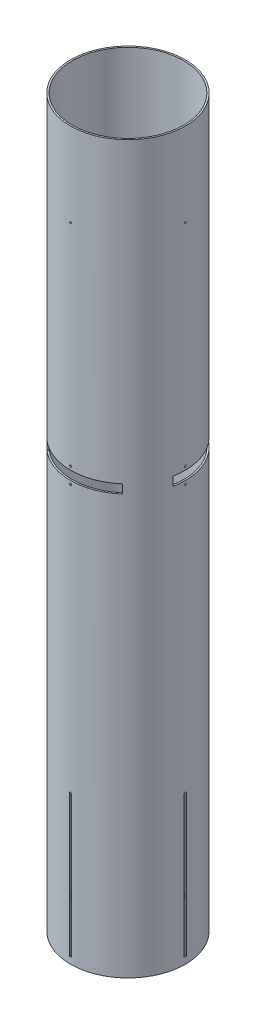
from build123d import *

# Parameters (mm, degrees)
SKETCH1_R                 = 78.359
SKETCH1_R_2               = 76.2
BOSS_EXTRUDE1_DEPTH       = 990.6
FIN_SLOTS_DEPTH           = 997.779125866
CIRPATTERN1_COUNT         = 4
CUT_EXTRUDE2_DEPTH        = 997.779125866
CIRPATTERN2_COUNT         = 4
SKETCH3_R                 = 3.175
CUT_EXTRUDE3_DEPTH        = 997.779125981
CUT_EXTRUDE4_START        = -12.065
CUT_EXTRUDE4_DEPTH        = 12.065
CIRPATTERN3_COUNT         = 3
SKETCH2_4_R               = 1.0922
SHEAR_SCREW_HOLES_DEPTH   = 997.779125981
SHEAR_SCREW_PATTERN_COUNT = 4
LPATTERN1_COUNT           = 2
LPATTERN1_PITCH           = 21.52396
LPATTERN1_COPY_1_DEPTH    = 997.779125866
LPATTERN1_COPY_2_DEPTH    = 997.779125866
LPATTERN1_COPY_3_DEPTH    = 997.779125866


with BuildPart() as part:
    # Sketch1 → Boss-Extrude1 (new body)
    with BuildSketch(Plane(origin=(0, 0, 0), x_dir=(1, 0, 0), z_dir=(0, 1, 0))):
        Circle(SKETCH1_R)
        Circle(SKETCH1_R_2, mode=Mode.SUBTRACT)
    extrude(amount=BOSS_EXTRUDE1_DEPTH)

    # Sketch2 → Fin Slots (cut, through all)
    with BuildSketch(Plane(origin=(0, 0, 0), x_dir=(0, 0, -1), z_dir=(1, 0, 0))):
        Polygon((0, 8.89), (1.5875, 8.89), (1.5875, 203.2), (-1.5875, 203.2), (-1.5875, 8.89), align=None)
    fin_slots = extrude(amount=-FIN_SLOTS_DEPTH, mode=Mode.SUBTRACT)

    # CirPattern1: Fin Slots ×4 about axis
    cirpattern1_axis = Axis((0, 0, 0), (0, 1, 0))
    for i in range(1, CIRPATTERN1_COUNT):
        add(fin_slots.rotate(cirpattern1_axis, i * 360 / CIRPATTERN1_COUNT), mode=Mode.SUBTRACT)

    # Sketch2<3> → Cut-Extrude2 (cut, through all)
    with BuildSketch(Plane(origin=(0, 0, 0), x_dir=(0, 0, -1), z_dir=(1, 0, 0))):
        with BuildLine():
            ThreePointArc((1.35255, 588.645), (0.956397277, 589.601397277), (0, 589.99755))
            ThreePointArc((0, 589.99755), (-0.956397277, 587.688602723), (1.35255, 588.645))
        make_face()
    cut_extrude2 = extrude(amount=-CUT_EXTRUDE2_DEPTH, mode=Mode.SUBTRACT)

    # CirPattern2: Cut-Extrude2 ×4 about axis
    cirpattern2_axis = Axis((0, 990.6, 0), (0, -1, 0))
    for i in range(1, CIRPATTERN2_COUNT):
        add(cut_extrude2.rotate(cirpattern2_axis, i * 360 / CIRPATTERN2_COUNT), mode=Mode.SUBTRACT)

    # Sketch3 → Cut-Extrude3 (cut, through all)
    with BuildSketch(Plane(origin=(0, 0, 0), x_dir=(0.7071067811865477, 0, -0.7071067811865475), z_dir=(0.7071067811865475, 0, 0.7071067811865477))):
        with Locations((0, 127)):
            Circle(SKETCH3_R)
    extrude(amount=-CUT_EXTRUDE3_DEPTH, mode=Mode.SUBTRACT)

    # Sketch7 → Cut-Extrude4 (cut)
    with BuildSketch(Plane(origin=(0, 583.8825, 0), x_dir=(1, 0, 0), z_dir=(0, 1, 0)).offset(CUT_EXTRUDE4_START)):
        with BuildLine():
            Line((-76.853353787, -15.287082543), (-74.735838367, -14.865882538))
            ThreePointArc((-74.735838367, -14.865882538), (-65.991135768, 38.1), (-24.493687256, 72.156075868))
            Line((-24.493687256, 72.156075868), (-25.187675062, 74.200498017))
            ThreePointArc((-25.187675062, 74.200498017), (-63.297551242, 46.190398221), (-78.347325988, 1.35255))
            ThreePointArc((-78.347325988, 1.35255), (-78.359, 0), (-78.347325988, -1.35255))
            ThreePointArc((-78.347325988, -1.35255), (-77.912486483, -8.35328265), (-76.853353787, -15.287082543))
        make_face()
    cut_extrude4 = extrude(amount=CUT_EXTRUDE4_DEPTH, mode=Mode.SUBTRACT)

    # CirPattern3: Cut-Extrude4 ×3 about axis
    cirpattern3_axis = Axis((0, 990.6, 0), (0, -1, 0))
    for i in range(1, CIRPATTERN3_COUNT):
        add(cut_extrude4.rotate(cirpattern3_axis, i * 360 / CIRPATTERN3_COUNT), mode=Mode.SUBTRACT)

    # Sketch2<4> → Shear Screw Holes (cut, through all)
    with BuildSketch(Plane(origin=(0, 0, 0), x_dir=(0, 0, -1), z_dir=(1, 0, 0))):
        with Locations((0, 876.3)):
            Circle(SKETCH2_4_R)
    shear_screw_holes = extrude(amount=-SHEAR_SCREW_HOLES_DEPTH, mode=Mode.SUBTRACT)

    # Shear Screw Pattern: Shear Screw Holes ×4 about axis
    shear_screw_pattern_axis = Axis((0, 990.6, 0), (0, -1, 0))
    for i in range(1, SHEAR_SCREW_PATTERN_COUNT):
        add(shear_screw_holes.rotate(shear_screw_pattern_axis, i * 360 / SHEAR_SCREW_PATTERN_COUNT), mode=Mode.SUBTRACT)

    # LPattern1: Cut-Extrude2 ×2
    with Locations(*[(0, -i * LPATTERN1_PITCH, 0) for i in range(1, LPATTERN1_COUNT)]):
        add(cut_extrude2, mode=Mode.SUBTRACT)

    # LPattern1 copy 1 sketch → LPattern1 copy 1 (cut, through all)
    with BuildSketch(Plane(origin=(0, -21.52396, 0), x_dir=(1, 0, 0), z_dir=(0, 0, 1))):
        with BuildLine():
            ThreePointArc((1.35255, 588.645), (0.956397277, 589.601397277), (0, 589.99755))
            ThreePointArc((0, 589.99755), (-0.956397277, 587.688602723), (1.35255, 588.645))
        make_face()
    extrude(amount=-LPATTERN1_COPY_1_DEPTH, mode=Mode.SUBTRACT)

    # LPattern1 copy 2 sketch → LPattern1 copy 2 (cut, through all)
    with BuildSketch(Plane(origin=(0, -21.52396, 0), x_dir=(0, 0, 1), z_dir=(-1, 0, 0))):
        with BuildLine():
            ThreePointArc((1.35255, 588.645), (0.956397277, 589.601397277), (0, 589.99755))
            ThreePointArc((0, 589.99755), (-0.956397277, 587.688602723), (1.35255, 588.645))
        make_face()
    extrude(amount=-LPATTERN1_COPY_2_DEPTH, mode=Mode.SUBTRACT)

    # LPattern1 copy 3 sketch → LPattern1 copy 3 (cut, through all)
    with BuildSketch(Plane(origin=(0, -21.52396, 0), x_dir=(-1, 0, 0), z_dir=(0, 0, -1))):
        with BuildLine():
            ThreePointArc((1.35255, 588.645), (0.956397277, 589.601397277), (0, 589.99755))
            ThreePointArc((0, 589.99755), (-0.956397277, 587.688602723), (1.35255, 588.645))
        make_face()
    extrude(amount=-LPATTERN1_COPY_3_DEPTH, mode=Mode.SUBTRACT)


solid = part.part
